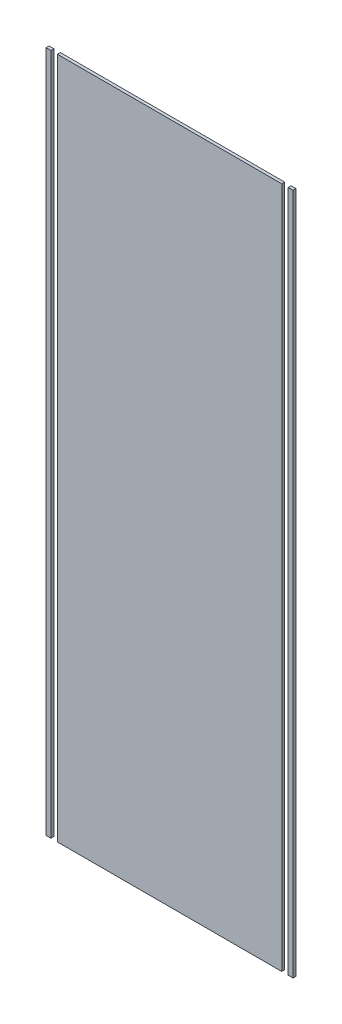
from build123d import *

# Parameters (mm, degrees)
SKETCH_1_W        = 10
SKETCH_1_H        = 1396
EXTRUDE_1_DEPTH   = 6
EXTRUDE_1_2_DEPTH = 6
SKETCH_1_W_2      = 459.3
EXTRUDE_1_3_DEPTH = 6


with BuildPart() as part:
    # Эскиз1 → Бобышка-Вытянуть1 (new body)
    with BuildSketch(Plane.XY):
        with Locations((578.5, -251)):
            Rectangle(SKETCH_1_W, SKETCH_1_H)
    extrude(amount=EXTRUDE_1_DEPTH)


with BuildPart() as body_2:
    # Эскиз1 → Extrude 1 2 (new body)
    with BuildSketch(Plane.XY):
        with Locations((1073.8, -251)):
            Rectangle(SKETCH_1_W, SKETCH_1_H)
    extrude(amount=EXTRUDE_1_2_DEPTH)


with BuildPart() as body_3:
    # Эскиз1 → Extrude 1 3 (new body)
    with BuildSketch(Plane.XY):
        with Locations((826.15, -251)):
            Rectangle(SKETCH_1_W_2, SKETCH_1_H)
    extrude(amount=EXTRUDE_1_3_DEPTH)


solid = Compound([part.part, body_2.part, body_3.part])
